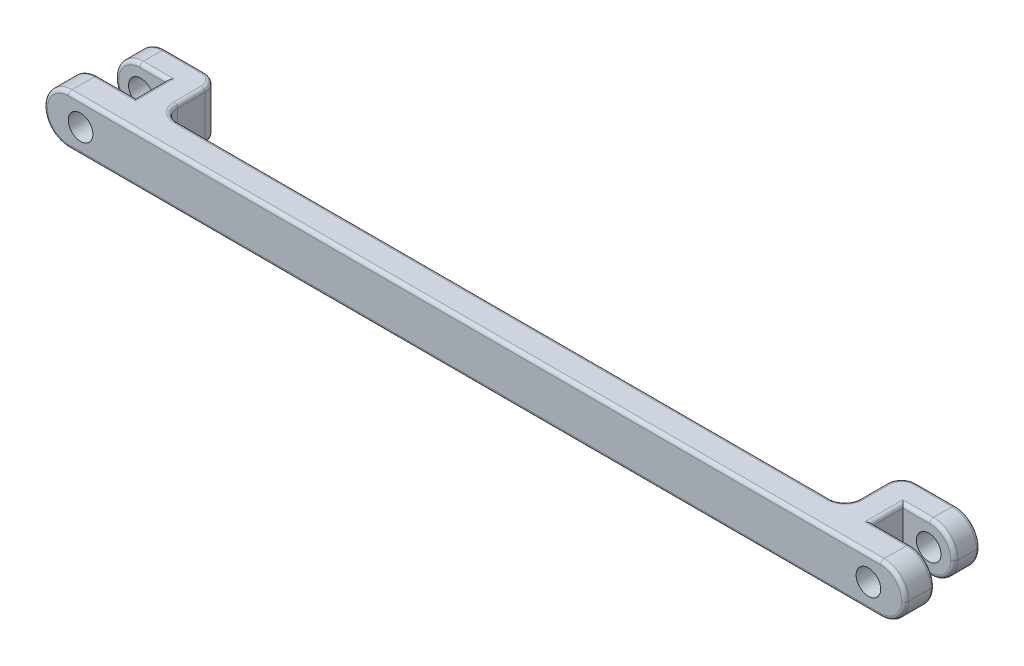
from build123d import *

# Parameters (mm, degrees)
Y_KSEKLIK_EKSTR_ZYON1_DEPTH = 67
KES_EKSTR_ZYON1_REACH       = 603.135
IZIM3_R                     = 16.75
RADYUS1_R                   = 20
RADYUS2_R                   = 33.5
RADYUS4_R                   = 5


with BuildPart() as part:
    # Çizim2 → Yükseklik-Ekstrüzyon1 (new body)
    with BuildSketch(Plane(origin=(0, 0, 0), x_dir=(1, 0, 0), z_dir=(0, 1, 0))):
        Polygon((-585.82, 40), (-585.82, 0), (0, 0), (0, 40), (-463.82, 40), (-463.82, 117), (-570.82, 117), (-570.82, 82), (-500.82, 82), (-500.82, 40), align=None)
        Polygon((0, 40), (0, 0), (585.82, 0), (585.82, 40), (500.82, 40), (500.82, 82), (570.82, 82), (570.82, 117), (463.82, 117), (463.82, 40), align=None)
    extrude(amount=Y_KSEKLIK_EKSTR_ZYON1_DEPTH)

    # Kes-Ekstrüzyon1: up to this face of the body (flat: up to its plane)
    kes_ekstr_zyon1_end = Plane(part.part.faces().sort_by_distance((0, 33.5, 0))[0])
    # Çizim3 → Kes-Ekstrüzyon1 (cut, up to the picked face)
    with BuildSketch(Plane(origin=(0, 0, -117), x_dir=(-1, 0, 0), z_dir=(0, 0, -1)), mode=Mode.PRIVATE) as kes_ekstr_zyon1_sk1:
        with Locations((-535.82, 33.5)):
            Circle(IZIM3_R)
    kes_ekstr_zyon1_tool1 = split(extrude(kes_ekstr_zyon1_sk1.sketch, amount=-KES_EKSTR_ZYON1_REACH, mode=Mode.PRIVATE), bisect_by=kes_ekstr_zyon1_end, keep=Keep.BOTH, mode=Mode.PRIVATE)
    # Çizim3 → Kes-Ekstrüzyon1 (cut, up to the picked face)
    with BuildSketch(Plane(origin=(0, 0, -117), x_dir=(-1, 0, 0), z_dir=(0, 0, -1)), mode=Mode.PRIVATE) as kes_ekstr_zyon1_sk2:
        with Locations((535.82, 33.5)):
            Circle(IZIM3_R)
    kes_ekstr_zyon1_tool2 = split(extrude(kes_ekstr_zyon1_sk2.sketch, amount=-KES_EKSTR_ZYON1_REACH, mode=Mode.PRIVATE), bisect_by=kes_ekstr_zyon1_end, keep=Keep.BOTH, mode=Mode.PRIVATE)
    add(kes_ekstr_zyon1_tool1.solids().sort_by(Axis((535.82, 33.5, -117), (0, 0, 1)))[0], mode=Mode.SUBTRACT)
    add(kes_ekstr_zyon1_tool2.solids().sort_by(Axis((-535.82, 33.5, -117), (0, 0, 1)))[0], mode=Mode.SUBTRACT)

    # Radyus1
    radyus1_edges = [part.edges().sort_by_distance(p)[0] for p in [
        (-463.82, 33.5, -117),
        (-463.82, 33.5, -40),
        (463.82, 33.5, -40),
        (463.82, 33.5, -117),
    ]]
    fillet(radyus1_edges, radius=RADYUS1_R)

    # Radyus2
    radyus2_edges = [part.edges().sort_by_distance(p)[0] for p in [
        (-585.82, 0, -20),
        (-585.82, 67, -20),
        (585.82, 0, -20),
        (585.82, 67, -20),
        (570.82, 67, -99.5),
        (570.82, 0, -99.5),
        (-570.82, 0, -99.5),
        (-570.82, 67, -99.5),
    ]]
    fillet(radyus2_edges, radius=RADYUS2_R - 0.0001)  # a hair under: the kernel refuses the full size

    # Radyus4
    radyus4_edges = [part.edges().sort_by_distance(p)[0] for p in [
        (-510.57005, 67, -117),
        (526.57005, 67, -40),
        (576.008106459, 57.188106459, -40),
        (576.008106459, 9.811893541, -40),
        (561.008106459, 9.811893541, -117),
        (561.008106459, 57.188106459, -117),
        (561.008106459, 9.811893541, -82),
        (561.008106459, 57.188106459, -82),
        (-561.008106459, 57.188106459, -117),
        (-561.008106459, 9.811893541, -117),
        (-561.008106459, 57.188106459, -82),
        (-561.008106459, 9.811893541, -82),
        (-519.07005, 0, -82),
        (500.82, 67, -61),
        (519.07005, 0, -82),
        (519.07005, 67, -82),
        (-519.07005, 67, -82),
        (-500.82, 67, -61),
        (463.82, 0, -78.5),
        (463.82, 67, -78.5),
        (-463.82, 0, -78.5),
        (0, 0, -40),
        (-469.677864376, 0, -111.142135624),
        (469.677864376, 0, -111.142135624),
        (0, 67, -40),
        (-463.82, 67, -78.5),
        (-469.677864376, 67, -111.142135624),
        (469.677864376, 67, -111.142135624),
        (457.962135624, 0, -45.857864376),
        (457.962135624, 67, -45.857864376),
        (-457.962135624, 0, -45.857864376),
        (-457.962135624, 67, -45.857864376),
        (510.57005, 0, -117),
        (526.57005, 0, -40),
        (0, 0, 0),
        (-526.57005, 0, -40),
        (-510.57005, 0, -117),
        (-526.57005, 67, -40),
        (-576.008106459, 57.188106459, -40),
        (-576.008106459, 9.811893541, -40),
        (0, 67, 0),
        (576.008106459, 57.188106459, 0),
        (576.008106459, 9.811893541, 0),
        (-576.008106459, 57.188106459, 0),
        (-576.008106459, 9.811893541, 0),
        (510.57005, 67, -117),
    ]]
    fillet(radyus4_edges, radius=RADYUS4_R)


solid = part.part
